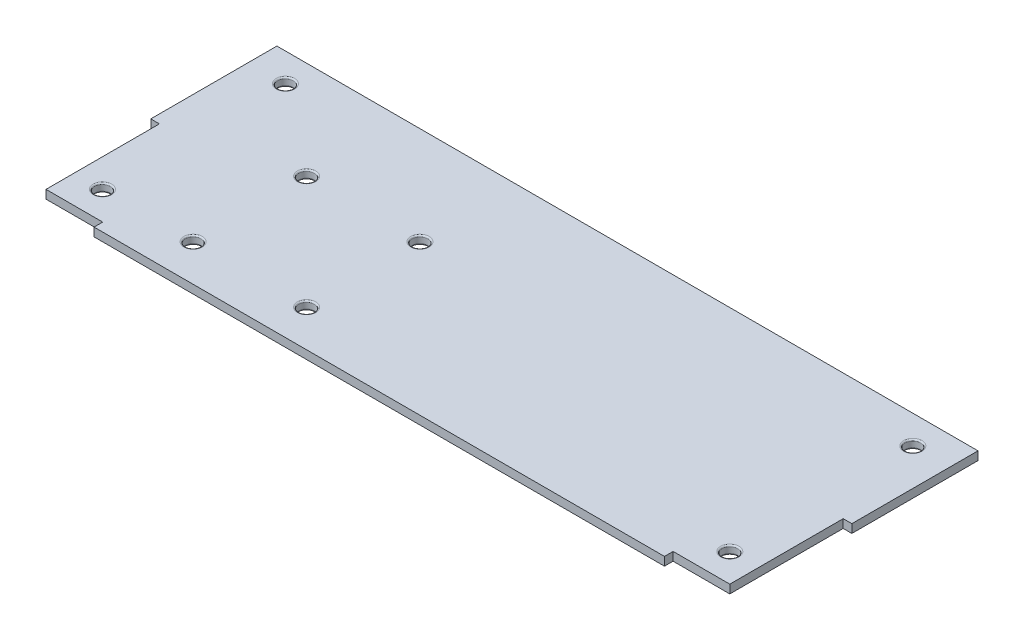
from build123d import *

# Parameters (mm, degrees)
SKETCH1_W           = 247.3
SKETCH1_H           = 87.55
BOSS_EXTRUDE1_DEPTH = 3
CUT_EXTRUDE2_DEPTH  = 132.204318241
SKETCH2_R           = 2.75
CUT_EXTRUDE1_DEPTH  = 132.204318241
FILLET1_R           = 0.5
SKETCH11_R          = 2.75
CUT_EXTRUDE9_DEPTH  = 132.204318241
FILLET5_R           = 0.5


with BuildPart() as part:
    # Sketch1 → Boss-Extrude1 (new body)
    with BuildSketch(Plane(origin=(0, 0, 0), x_dir=(1, 0, 0), z_dir=(0, 1, 0))):
        Rectangle(SKETCH1_W, SKETCH1_H)
    extrude(amount=BOSS_EXTRUDE1_DEPTH)

    # Sketch4 → Cut-Extrude2 (cut, through all)
    with BuildSketch(Plane(origin=(0, 3, 0), x_dir=(1, 0, 0), z_dir=(0, 1, 0))):
        Polygon((-123.65, -43.775), (-120.6, -43.775), (-100.6, -43.775), (-100.6, -40.725), (-120.6, -40.725), (-120.6, -0.725), (-123.65, -0.725), align=None)
        Polygon((100.6, -43.775), (100.6, -40.725), (120.6, -40.725), (120.6, -0.725), (123.65, -0.725), (123.65, -43.775), (120.6, -43.775), align=None)
    extrude(amount=-CUT_EXTRUDE2_DEPTH, mode=Mode.SUBTRACT)

    # Sketch2 → Cut-Extrude1 (cut, through all)
    with BuildSketch(Plane(origin=(0, 3, 0), x_dir=(1, 0, 0), z_dir=(0, 1, 0))):
        with Locations((-110.65, 33.775)):
            Circle(SKETCH2_R)
        with Locations((110.65, 33.775)):
            Circle(SKETCH2_R)
        with Locations((-110.65, -30.775)):
            Circle(SKETCH2_R)
        with Locations((110.65, -30.775)):
            Circle(SKETCH2_R)
    extrude(amount=-CUT_EXTRUDE1_DEPTH, mode=Mode.SUBTRACT)

    # Fillet1
    fillet1_edges = [part.edges().sort_by_distance(p)[0] for p in [
        (-113.4, 3, -33.775),
        (-113.4, 0, -33.775),
        (107.9, 3, -33.775),
        (107.9, 0, -33.775),
        (-113.4, 3, 30.775),
        (-113.4, 0, 30.775),
        (107.9, 3, 30.775),
        (107.9, 0, 30.775),
    ]]
    fillet(fillet1_edges, radius=FILLET1_R)

    # Sketch11 → Cut-Extrude9 (cut, through all)
    with BuildSketch(Plane(origin=(0, 3, 0), x_dir=(1, 0, 0), z_dir=(0, 1, 0))):
        with Locations((-78.65, -30.775)):
            Circle(SKETCH11_R)
        with Locations((-78.65, 9.225)):
            Circle(SKETCH11_R)
        with Locations((-38.65, 9.225)):
            Circle(SKETCH11_R)
        with Locations((-38.65, -30.775)):
            Circle(SKETCH11_R)
    extrude(amount=-CUT_EXTRUDE9_DEPTH, mode=Mode.SUBTRACT)

    # Fillet5
    fillet5_edges = [part.edges().sort_by_distance(p)[0] for p in [
        (-81.4, 3, -9.225),
        (-81.4, 0, -9.225),
        (-81.4, 3, 30.775),
        (-81.4, 0, 30.775),
        (-41.4, 3, 30.775),
        (-41.4, 0, 30.775),
        (-41.4, 3, -9.225),
        (-41.4, 0, -9.225),
    ]]
    fillet(fillet5_edges, radius=FILLET5_R)


solid = part.part
